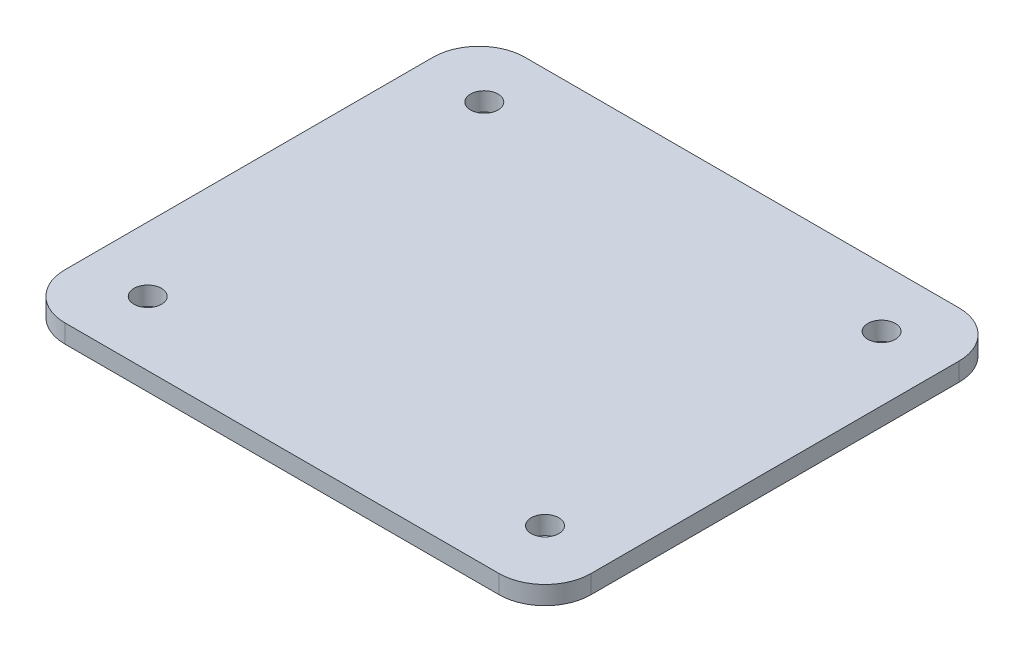
from build123d import *

# Parameters (mm, degrees)
SKETCH1_W           = 57.18
SKETCH1_H           = 50
SKETCH1_R           = 1.5
BOSS_EXTRUDE1_DEPTH = 2
FILLET2_R           = 5


with BuildPart() as part:
    # Sketch1 → Boss-Extrude1 (new body)
    with BuildSketch(Plane(origin=(0, 0, 0), x_dir=(1, 0, 0), z_dir=(0, 1, 0))):
        with Locations((28.59, -25)):
            Rectangle(SKETCH1_W, SKETCH1_H)
        with Locations((7, -6.42)):
            Circle(SKETCH1_R, mode=Mode.SUBTRACT)
        with Locations((50.18, -6.42)):
            Circle(SKETCH1_R, mode=Mode.SUBTRACT)
        with Locations((50.18, -43)):
            Circle(SKETCH1_R, mode=Mode.SUBTRACT)
        with Locations((7, -43)):
            Circle(SKETCH1_R, mode=Mode.SUBTRACT)
    extrude(amount=BOSS_EXTRUDE1_DEPTH)

    # Fillet2
    fillet2_edges = [part.edges().sort_by_distance(p)[0] for p in [
        (57.18, 1, 0),
        (0, 1, 0),
        (57.18, 1, 50),
        (0, 1, 50),
    ]]
    fillet(fillet2_edges, radius=FILLET2_R)


solid = part.part
